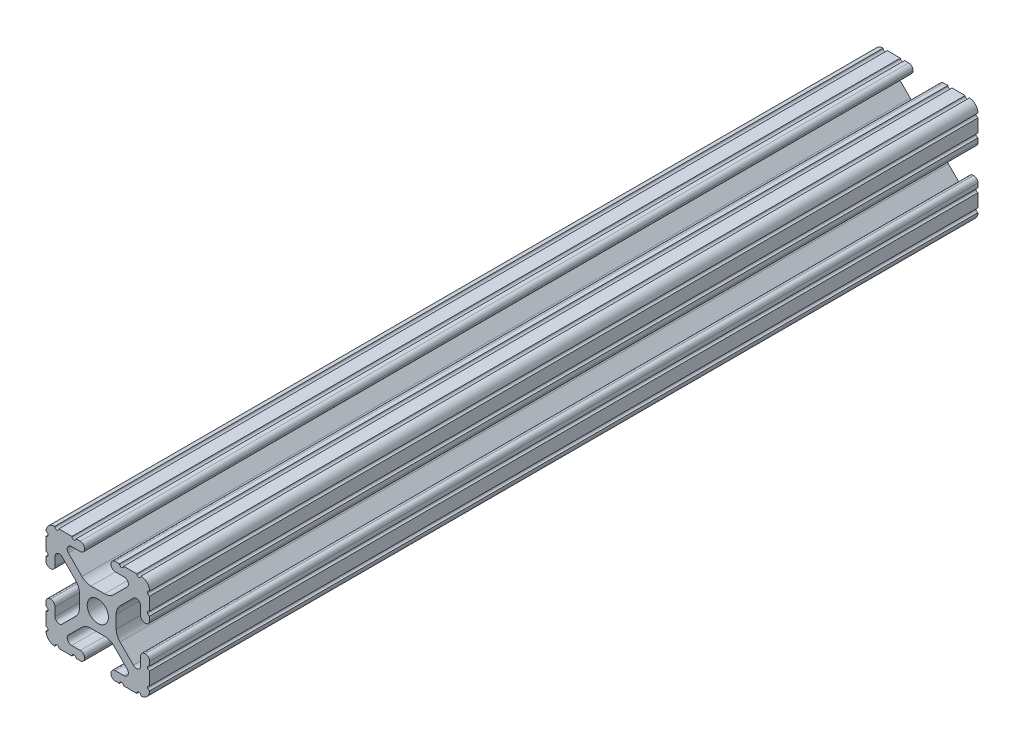
from build123d import *

# Parameters (mm, degrees)
SKETCH1_R               = 2.6035
BOSS_EXTRUDE1_DEPTH     = 304.8
CUT_EXTRUDE1_DEPTH      = 1.778
CUT_EXTRUDE1_DEPTH_BACK = 26.162
SKETCH2_W               = 16.257599062
SKETCH2_H               = 27.586789262


with BuildPart() as part:
    # Sketch1 → Boss-Extrude1 (new, symmetric)
    with BuildSketch(Plane.XY):
        with BuildLine():
            Line((-7.179650497, -8.645192506), (-3.952270251, -5.423690499))
            ThreePointArc((-3.952270251, -5.423690499), (-2.922936451, -4.736929036), (-1.709253557, -4.4958))
            Line((-1.709253557, -4.4958), (1.709253557, -4.4958))
            ThreePointArc((1.709253557, -4.4958), (2.922936451, -4.736929036), (3.952270251, -5.423690499))
            Line((3.952270251, -5.423690499), (7.179650497, -8.645192506))
            ThreePointArc((7.179650497, -8.645192506), (7.41473083, -9.822813117), (6.416408329, -10.4902))
            Line((6.416408329, -10.4902), (4.287512407, -10.4902))
            ThreePointArc((4.287512407, -10.4902), (3.54574862, -10.79744862), (3.2385, -11.539212407))
            Line((3.2385, -11.539212407), (3.2385, -11.650987593))
            ThreePointArc((3.2385, -11.650987593), (3.54574862, -12.39275138), (4.287512407, -12.7))
            Line((4.287512407, -12.7), (5.317126718, -12.7))
            ThreePointArc((5.317126718, -12.7), (5.825126718, -12.192), (6.333126718, -12.7))
            Line((6.333126718, -12.7), (9.550443118, -12.7))
            ThreePointArc((9.550443118, -12.7), (10.058366869, -12.192000006), (10.566443095, -12.699847501))
            ThreePointArc((10.566443095, -12.699847501), (12.082537762, -12.08250727), (12.699846982, -10.566399977))
            ThreePointArc((12.699846982, -10.566399977), (12.192000006, -10.058323491), (12.7, -9.5504))
            Line((12.7, -9.5504), (12.7, -6.3330836))
            ThreePointArc((12.7, -6.3330836), (12.192, -5.8250836), (12.7, -5.3170836))
            Line((12.7, -5.3170836), (12.7, -4.287469289))
            ThreePointArc((12.7, -4.287469289), (12.39275138, -3.545705502), (11.650987593, -3.238456882))
            Line((11.650987593, -3.238456882), (11.539212407, -3.238456882))
            ThreePointArc((11.539212407, -3.238456882), (10.79744862, -3.545705502), (10.4902, -4.287469289))
            Line((10.4902, -4.287469289), (10.4902, -6.402089023))
            ThreePointArc((10.4902, -6.402089023), (9.856505071, -7.351067942), (8.737131347, -7.129408934))
            Line((8.737131347, -7.129408934), (5.441005833, -3.840816462))
            ThreePointArc((5.441005833, -3.840816462), (4.750877967, -2.809883091), (4.5085, -1.593185507))
            Line((4.5085, -1.593185507), (4.5085, 1.593185507))
            ThreePointArc((4.5085, 1.593185507), (4.750877967, 2.809883091), (5.441005833, 3.840816462))
            Line((5.441005833, 3.840816462), (8.737131347, 7.129408934))
            ThreePointArc((8.737131347, 7.129408934), (9.856505071, 7.351067942), (10.4902, 6.402089023))
            Line((10.4902, 6.402089023), (10.4902, 4.287469289))
            ThreePointArc((10.4902, 4.287469289), (10.79744862, 3.545705502), (11.539212407, 3.238456882))
            Line((11.539212407, 3.238456882), (11.650987593, 3.238456882))
            ThreePointArc((11.650987593, 3.238456882), (12.39275138, 3.545705502), (12.7, 4.287469289))
            Line((12.7, 4.287469289), (12.7, 5.3170836))
            ThreePointArc((12.7, 5.3170836), (12.192, 5.8250836), (12.7, 6.3330836))
            Line((12.7, 6.3330836), (12.7, 9.5504))
            ThreePointArc((12.7, 9.5504), (12.192000006, 10.058323491), (12.699846982, 10.566399977))
            ThreePointArc((12.699846982, 10.566399977), (12.082537762, 12.08250727), (10.566443095, 12.699847501))
            ThreePointArc((10.566443095, 12.699847501), (10.058366869, 12.192000006), (9.550443118, 12.7))
            Line((9.550443118, 12.7), (6.333126718, 12.7))
            ThreePointArc((6.333126718, 12.7), (5.825126718, 12.192), (5.317126718, 12.7))
            Line((5.317126718, 12.7), (4.287512407, 12.7))
            ThreePointArc((4.287512407, 12.7), (3.54574862, 12.39275138), (3.2385, 11.650987593))
            Line((3.2385, 11.650987593), (3.2385, 11.539212407))
            ThreePointArc((3.2385, 11.539212407), (3.54574862, 10.79744862), (4.287512407, 10.4902))
            Line((4.287512407, 10.4902), (6.476788598, 10.4902))
            ThreePointArc((6.476788598, 10.4902), (7.432222385, 9.85140422), (7.207036008, 8.724370562))
            Line((7.207036008, 8.724370562), (3.898272566, 5.423169045))
            ThreePointArc((3.898272566, 5.423169045), (2.869120213, 4.736787962), (1.655778399, 4.4958))
            Line((1.655778399, 4.4958), (-1.655778399, 4.4958))
            ThreePointArc((-1.655778399, 4.4958), (-2.869120213, 4.736787962), (-3.898272566, 5.423169045))
            Line((-3.898272566, 5.423169045), (-7.207036008, 8.724370562))
            ThreePointArc((-7.207036008, 8.724370562), (-7.432222385, 9.85140422), (-6.476788598, 10.4902))
            Line((-6.476788598, 10.4902), (-4.287512407, 10.4902))
            ThreePointArc((-4.287512407, 10.4902), (-3.54574862, 10.79744862), (-3.2385, 11.539212407))
            Line((-3.2385, 11.539212407), (-3.2385, 11.650987593))
            ThreePointArc((-3.2385, 11.650987593), (-3.54574862, 12.39275138), (-4.287512407, 12.7))
            Line((-4.287512407, 12.7), (-5.317126718, 12.7))
            ThreePointArc((-5.317126718, 12.7), (-5.825126718, 12.192), (-6.333126718, 12.7))
            Line((-6.333126718, 12.7), (-9.550443118, 12.7))
            ThreePointArc((-9.550443118, 12.7), (-10.058366869, 12.192000006), (-10.566443095, 12.699847501))
            ThreePointArc((-10.566443095, 12.699847501), (-12.082537762, 12.08250727), (-12.699846982, 10.566399977))
            ThreePointArc((-12.699846982, 10.566399977), (-12.192000006, 10.058323491), (-12.7, 9.5504))
            Line((-12.7, 9.5504), (-12.7, 6.3330836))
            ThreePointArc((-12.7, 6.3330836), (-12.192, 5.8250836), (-12.7, 5.3170836))
            Line((-12.7, 5.3170836), (-12.7, 4.287469289))
            ThreePointArc((-12.7, 4.287469289), (-12.39275138, 3.545705502), (-11.650987593, 3.238456882))
            Line((-11.650987593, 3.238456882), (-11.539212407, 3.238456882))
            ThreePointArc((-11.539212407, 3.238456882), (-10.79744862, 3.545705502), (-10.4902, 4.287469289))
            Line((-10.4902, 4.287469289), (-10.4902, 6.402089023))
            ThreePointArc((-10.4902, 6.402089023), (-9.856505071, 7.351067942), (-8.737131347, 7.129408934))
            Line((-8.737131347, 7.129408934), (-5.441005833, 3.840816462))
            ThreePointArc((-5.441005833, 3.840816462), (-4.750877967, 2.809883091), (-4.5085, 1.593185507))
            Line((-4.5085, 1.593185507), (-4.5085, -1.593185507))
            ThreePointArc((-4.5085, -1.593185507), (-4.750877967, -2.809883091), (-5.441005833, -3.840816462))
            Line((-5.441005833, -3.840816462), (-8.737131347, -7.129408934))
            ThreePointArc((-8.737131347, -7.129408934), (-9.856505071, -7.351067942), (-10.4902, -6.402089023))
            Line((-10.4902, -6.402089023), (-10.4902, -4.287469289))
            ThreePointArc((-10.4902, -4.287469289), (-10.79744862, -3.545705502), (-11.539212407, -3.238456882))
            Line((-11.539212407, -3.238456882), (-11.650987593, -3.238456882))
            ThreePointArc((-11.650987593, -3.238456882), (-12.39275138, -3.545705502), (-12.7, -4.287469289))
            Line((-12.7, -4.287469289), (-12.7, -5.3170836))
            ThreePointArc((-12.7, -5.3170836), (-12.192, -5.8250836), (-12.7, -6.3330836))
            Line((-12.7, -6.3330836), (-12.7, -9.5504))
            ThreePointArc((-12.7, -9.5504), (-12.192000006, -10.058323491), (-12.699846982, -10.566399977))
            ThreePointArc((-12.699846982, -10.566399977), (-12.082537762, -12.08250727), (-10.566443095, -12.699847501))
            ThreePointArc((-10.566443095, -12.699847501), (-10.058366869, -12.192000006), (-9.550443118, -12.7))
            Line((-9.550443118, -12.7), (-6.333126718, -12.7))
            ThreePointArc((-6.333126718, -12.7), (-5.825126718, -12.192), (-5.317126718, -12.7))
            Line((-5.317126718, -12.7), (-4.287512407, -12.7))
            ThreePointArc((-4.287512407, -12.7), (-3.54574862, -12.39275138), (-3.2385, -11.650987593))
            Line((-3.2385, -11.650987593), (-3.2385, -11.539212407))
            ThreePointArc((-3.2385, -11.539212407), (-3.54574862, -10.79744862), (-4.287512407, -10.4902))
            Line((-4.287512407, -10.4902), (-6.416408329, -10.4902))
            ThreePointArc((-6.416408329, -10.4902), (-7.41473083, -9.822813117), (-7.179650497, -8.645192506))
        make_face()
        Circle(SKETCH1_R, mode=Mode.SUBTRACT)
    extrude(amount=BOSS_EXTRUDE1_DEPTH, both=True)

    # Sketch2 → Cut-Extrude1 (cut, two sides: drawn at the far end of the back side and taken through both)
    with BuildSketch(Plane(origin=(12.7, 0, 0), x_dir=(0, 0, -1), z_dir=(1, 0, 0)).offset(-CUT_EXTRUDE1_DEPTH_BACK)):
        Polygon((-56.586481007, -14.234528627), (310.743066166, -14.234528627), (310.743066166, 13.643777343), (-56.586481007, 13.643777343), (-86.12771422, 13.643777343), (-86.12771422, -14.234528627), align=None)
        with Locations((-297.347005301, -0.441133996)):
            Rectangle(SKETCH2_W, SKETCH2_H)
    extrude(amount=CUT_EXTRUDE1_DEPTH + CUT_EXTRUDE1_DEPTH_BACK, mode=Mode.SUBTRACT)


solid = part.part
